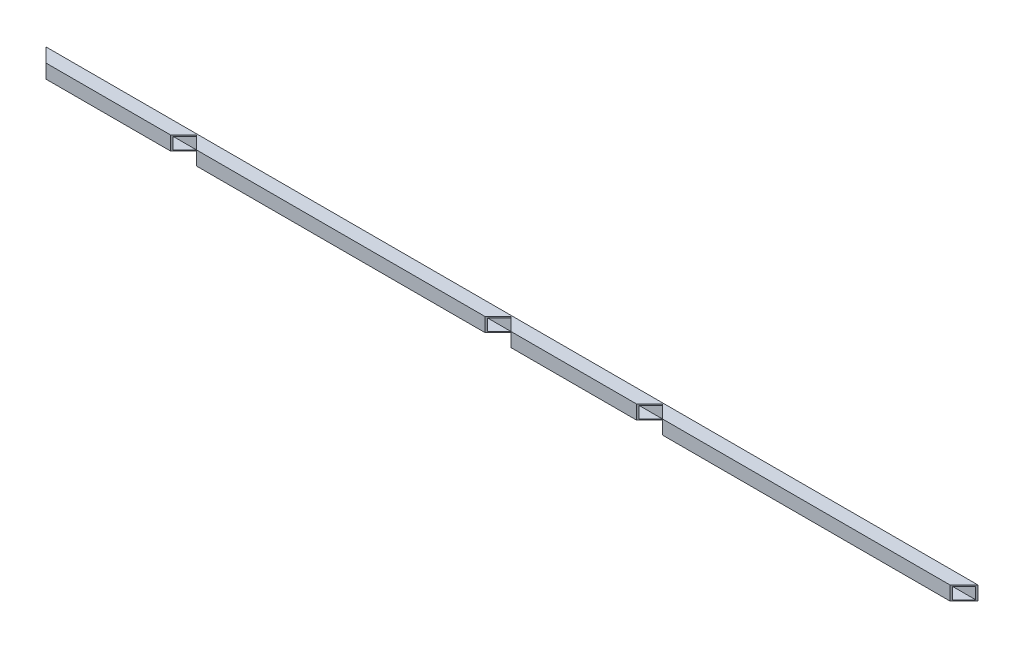
from build123d import *

# Parameters (mm, degrees)
SKETCH4_W          = 800
SKETCH4_H          = 12
BASE_FLANGE1_DEPTH = 12
SKETCH9_W          = 10
SKETCH9_H          = 10
CUT_EXTRUDE2_DEPTH = 801.112492091
CUT_EXTRUDE3_DEPTH = 72


# Sheet-metal steps are written as plain solids
with BuildPart() as part:
    # Sketch4 → Base-Flange1 (new body)
    with BuildSketch(Plane(origin=(0, 0, 0), x_dir=(1, 0, 0), z_dir=(0, 1, 0))):
        Rectangle(SKETCH4_W, SKETCH4_H)
    extrude(amount=-BASE_FLANGE1_DEPTH)

    # Sketch9 → Cut-Extrude2 (cut, through all)
    with BuildSketch(Plane(origin=(400, 0, 0), x_dir=(0, 0, -1), z_dir=(1, 0, 0))):
        with Locations((0, -6)):
            Rectangle(SKETCH9_W, SKETCH9_H)
    extrude(amount=-CUT_EXTRUDE2_DEPTH, mode=Mode.SUBTRACT)

    # Sketch12 → Cut-Extrude3 (cut)
    with BuildSketch(Plane(origin=(0, 0, 0), x_dir=(1, 0, 0), z_dir=(0, 1, 0))):
        Polygon((-270, 5), (-281, -6), (-259, -6), align=None)
        Polygon((11, -6), (0, 5), (-11, -6), align=None)
        Polygon((141, -6), (130, 5), (119, -6), align=None)
        Polygon((-400, 6), (-388, -6), (-400, -6), align=None)
        Polygon((400, -6), (400, 6), (388, -6), align=None)
    extrude(amount=-CUT_EXTRUDE3_DEPTH, mode=Mode.SUBTRACT)


solid = part.part
